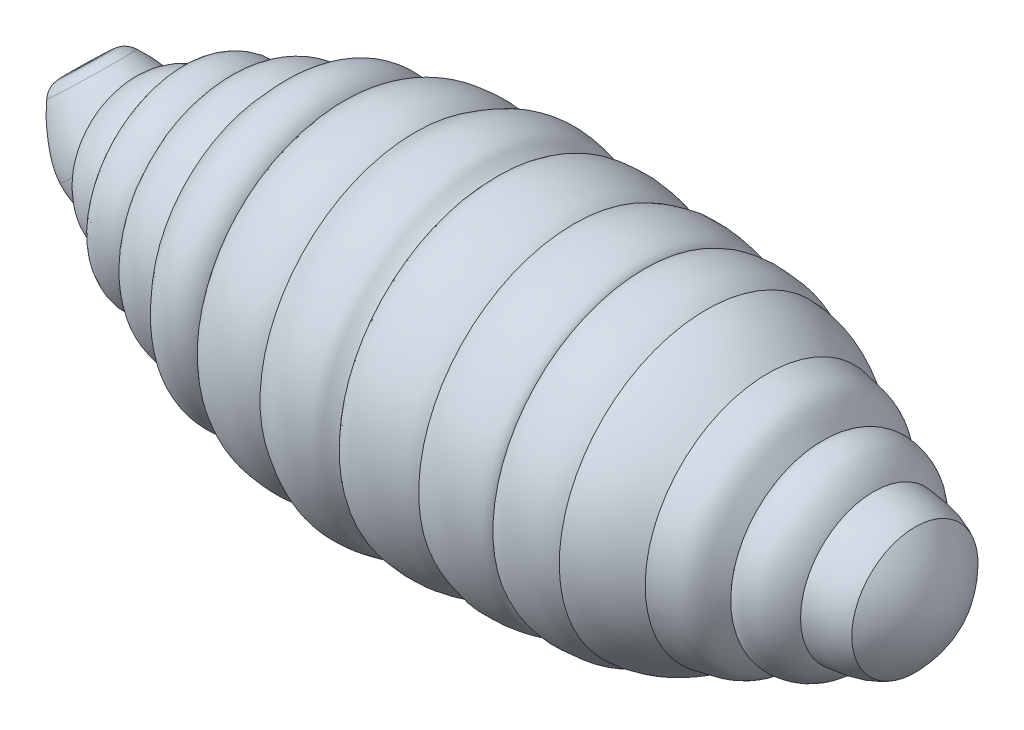
from build123d import *

# Parameters (mm, degrees)
TAGLIO_ESTRUSIONE2_DEPTH      = 10
TAGLIO_ESTRUSIONE2_DEPTH_BACK = 10
SCHIZZO8_R                    = 4.450442739
ESTRUSIONE_ESTRUSIONE1_DEPTH  = 3
RACCORDO4_R                   = 2


with BuildPart() as part:
    # Schizzo1 → Rivoluzione4 (revolve)
    with BuildSketch(Plane.XY):
        with BuildLine():
            add(Edge.make_bspline(
                [(-37, 8.669452885), (-37.568726197, 8.838389668), (-38.622243273, 8.895586115), (-39.927460661, 8.438736148), (-41.057207751, 7.849388494), (-41.667576709, 7.252749022), (-42, 6.893884896)],
                knots=[0, 0, 0, 0, 0.318968187, 0.548467597, 0.735630309, 1, 1, 1, 1], degree=3))
            Line((-42, 6.893884896), (-42, 0))
            Line((-42, 0), (50, 0))
            add(Edge.make_bspline(
                [(50, 0), (50, 3.701091183), (46.688871247, 7.157086577)],
                knots=[3.141592654, 3.141592654, 3.141592654, 3.507561692, 3.507561692, 3.507561692], degree=2, weights=[1, 0.983304995, 1]))
            add(Edge.make_bspline(
                [(42, 8.281047388), (43.595591978, 8.095438288), (45.25311792, 7.960655244), (46.688871247, 7.157086577)],
                knots=[0, 0, 0, 0, 1, 1, 1, 1], degree=3))
            add(Edge.make_bspline(
                [(36, 10.096770015), (36.164899774, 10.439442319), (36.69635178, 10.869149237), (37.74586276, 11.078212866), (38.687500101, 10.875779286), (39.765691934, 10.549759727), (40.897084526, 9.682087738), (41.642222356, 8.853422002), (42, 8.281047388)],
                knots=[0, 0, 0, 0, 0.152464573, 0.266191498, 0.427434589, 0.541585928, 0.725793912, 1, 1, 1, 1], degree=3))
            add(Edge.make_bspline(
                [(30, 13.903740197), (31.198333342, 13.619825725), (34.078915725, 13.506124818), (35.349792204, 11.004735033), (36, 10.096770015)],
                knots=[0, 0, 0, 0, 0.529447084, 1, 1, 1, 1], degree=3))
            add(Edge.make_bspline(
                [(23, 16.647979824), (25.621013296, 16.563310264), (27.904434931, 15.307377925), (30, 13.903740197)],
                knots=[0, 0, 0, 0, 1, 1, 1, 1], degree=3))
            add(Edge.make_bspline(
                [(16, 17.172769626), (16.409230685, 17.396852459), (17.018543871, 17.589453258), (17.907121077, 17.638800006), (18.204693061, 17.682365713), (18.607659449, 17.680884862), (18.951486991, 17.64123991), (20.313568849, 17.554875914), (21.409631282, 17.438918614), (22.544834093, 16.92244332), (23, 16.647979824)],
                knots=[0, 0, 0, 0, 0.20115166, 0.294305632, 0.364002236, 0.381415257, 0.46843584, 0.545691856, 0.779325231, 1, 1, 1, 1], degree=3))
            add(Edge.make_bspline(
                [(8, 17.588795583), (8.581951722, 17.880415979), (9.439989163, 18.052799001), (10.508152133, 18.334125134), (11.0618502, 18.297653454), (11.504045551, 18.299425124), (11.866363218, 18.309329607), (12.260615533, 18.267428003), (12.639076817, 18.231168998), (12.999538019, 18.187185925), (13.429476861, 18.131599424), (14.035419037, 18.008194846), (14.973698644, 17.825498382), (15.708897745, 17.556170403), (16, 17.172769626)],
                knots=[0, 0, 0, 0, 0.229372755, 0.317536007, 0.393855894, 0.427343112, 0.476843965, 0.524044559, 0.569820457, 0.613701787, 0.654707152, 0.72580178, 0.835933876, 1, 1, 1, 1], degree=3))
            add(Edge.make_bspline(
                [(-1, 17.588795583), (-0.614381517, 18.104201355), (0.33373508, 18.632641409), (1.652794481, 18.723773831), (2.53495211, 18.794772534), (3.272245155, 18.796180751), (3.89160747, 18.745865054), (4.475220008, 18.667212173), (4.992232521, 18.561560177), (5.542562506, 18.466666486), (6.114775901, 18.284622468), (6.681189576, 18.183291401), (7.330549371, 17.980405814), (7.737592637, 17.748797975), (8, 17.588795583)],
                knots=[0, 0, 0, 0, 0.19999337, 0.323104104, 0.414620344, 0.479251546, 0.555247359, 0.610372735, 0.664792722, 0.721612681, 0.786226373, 0.853650458, 0.902782427, 1, 1, 1, 1], degree=3))
            add(Edge.make_bspline(
                [(-10, 17.588795583), (-9.177640336, 18.086537953), (-7.798339755, 19.006968429), (-5.523541506, 19.318007794), (-3.936116913, 19.069156303), (-2.289211867, 18.752878882), (-1.616362993, 17.847197056), (-1, 17.588795583)],
                knots=[0, 0, 0, 0, 0.297871953, 0.496695395, 0.687344485, 0.793867052, 1, 1, 1, 1], degree=3))
            add(Edge.make_bspline(
                [(-19, 14.781376887), (-18.875934195, 16.028850536), (-17.57470819, 17.288440009), (-15.509771075, 18.075362609), (-14.023892113, 18.227221045), (-12.161510462, 18.392970535), (-10.797574386, 18.040114527), (-10, 17.588795583)],
                knots=[0, 0, 0, 0, 0.324864627, 0.474838109, 0.616409352, 0.74338577, 1, 1, 1, 1], degree=3))
            add(Edge.make_bspline(
                [(-26, 13.903740197), (-25.251899359, 14.696598848), (-24.203412338, 16.192179565), (-22.10966123, 16.67017973), (-20.365009815, 16.382364292), (-19.344111288, 15.54259426), (-19, 14.781376887)],
                knots=[0, 0, 0, 0, 0.396544677, 0.574715816, 0.715438823, 1, 1, 1, 1], degree=3))
            add(Edge.make_bspline(
                [(-32, 11.207580376), (-31.463877263, 12.095566033), (-30.504364925, 13.362444514), (-28.223448583, 14.201361086), (-26.870161367, 13.991889653), (-26, 13.903740197)],
                knots=[0, 0, 0, 0, 0.447477162, 0.624963351, 1, 1, 1, 1], degree=3))
            add(Edge.make_bspline(
                [(-37, 8.669452885), (-36.87497218, 9.410259784), (-36.755259998, 10.860592392), (-35.556407174, 11.468057963), (-34.994332182, 11.703673338), (-34.397215298, 11.722417647), (-33.846437797, 11.732623301), (-33.352067001, 11.681783497), (-32.935278868, 11.625258925), (-32.491096234, 11.487967975), (-32.190086118, 11.325095327), (-32, 11.207580376)],
                knots=[0, 0, 0, 0, 0.382043088, 0.47029916, 0.564740486, 0.641238462, 0.723825006, 0.801482707, 0.854067905, 0.904002141, 1, 1, 1, 1], degree=3))
        make_face()
    revolve(axis=Axis((-50, 0, 0), (1, 0, 0)))

    # Schizzo4 → Rivoluzione7 (revolve)
    with BuildSketch(Plane(origin=(0, 0, 0), x_dir=(1, 0, 0), z_dir=(0, 1, 0))):
        with BuildLine():
            Line((-42, -6.5), (-42, 6.5))
            ThreePointArc((-42, 6.5), (-48.5, 0), (-42, -6.5))
        make_face()
    revolve(axis=Axis((-42, 0, -8.281047388), (0, 0, 1)))

    # Schizzo7 → Taglio-Estrusione2 (cut, two sides: drawn at the far end of the back side and taken through both)
    with BuildSketch(Plane.XY.offset(-TAGLIO_ESTRUSIONE2_DEPTH_BACK)):
        Polygon((-49.964844097, 0), (-48.91920195, 0), (-42, 6.5), (-42, 8.092933246), (-41.830072025, 10.650135465), (-49.964844097, 6.095780109), align=None)
    extrude(amount=TAGLIO_ESTRUSIONE2_DEPTH + TAGLIO_ESTRUSIONE2_DEPTH_BACK, mode=Mode.SUBTRACT)

    # Schizzo8 → Estrusione-Estrusione1 (add)
    with BuildSketch(Plane(origin=(-22.932905707, 24.411908598, 0), x_dir=(0.7288405225032004, 0.6846834982364202, 0), z_dir=(-0.6846834982364202, 0.7288405225032004, 0))):
        with Locations((-30.611301945, 0)):
            Circle(SCHIZZO8_R)
    extrude(amount=ESTRUSIONE_ESTRUSIONE1_DEPTH)

    # Raccordo4
    raccordo4_edges = [part.edges().sort_by_distance(p)[0] for p in [
        (-50.541376517, 2.592232162, 0),
    ]]
    fillet(raccordo4_edges, radius=RACCORDO4_R)

    # Schizzo9 → Rivoluzione8 (revolve)
    with BuildSketch(Plane.XY):
        with BuildLine():
            Line((-42, 0), (-47.297713506, 5.639376865))
            add(Edge.make_bspline(
                [(-47.297713506, 5.639376865), (-47.858818922, 5.031308588), (-48.764733166, 4.408342158), (-49.706947994, 3.200072293), (-49.721245936, 1.863462232), (-49.291837217, 0.369883501), (-48.522537501, -1.796583579), (-46.848079514, -5.016765008), (-43.882214171, -6.539359082), (-42, -6.5)],
                knots=[0, 0, 0, 0, 0.14447023, 0.19644646, 0.261798802, 0.369333339, 0.472449495, 0.668415237, 1, 1, 1, 1], degree=3))
            Line((-42, -6.5), (-42, 0))
        make_face()
    revolve(axis=Axis((-47.297713506, 5.639376865, 0), (0.684683498236419, -0.7288405225032014, 0)))


solid = part.part
